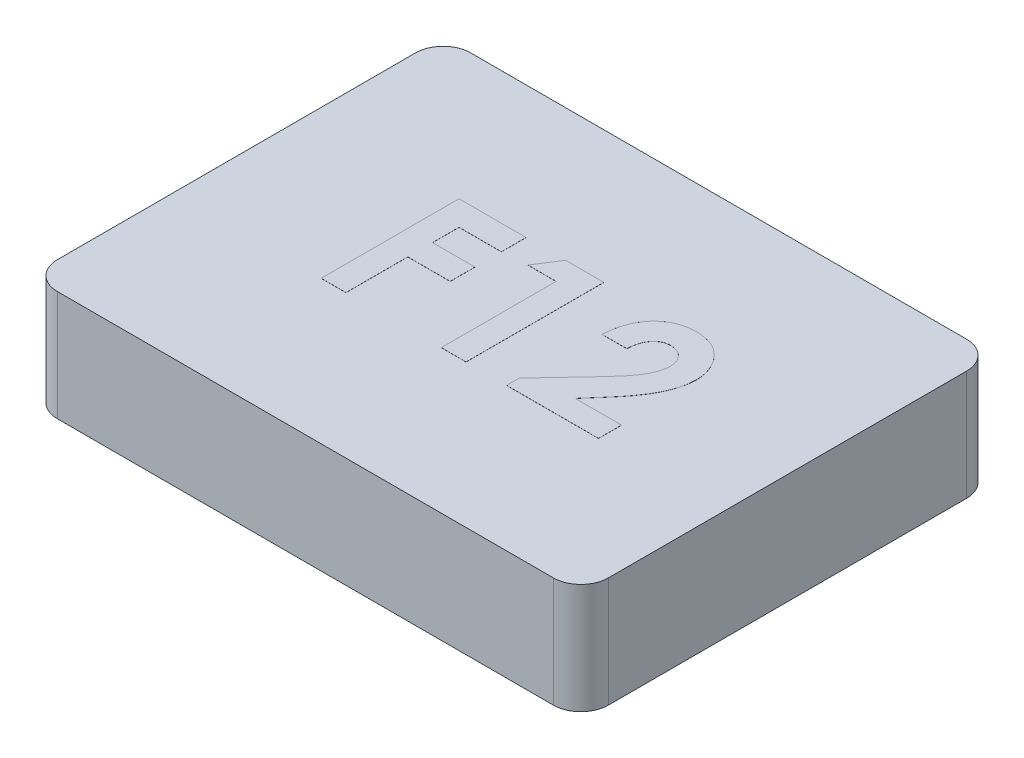
from build123d import *

# Parameters (mm, degrees)
SKETCH1_W           = 12.7
SKETCH1_H           = 9.525
BOSS_EXTRUDE1_DEPTH = 2.54
FILLET1_R           = 0.635
SHELL1_START        = 0.635
SHELL1_OUTLINE_W    = 1.905
SHELL1_OUTLINE_H    = 8.255
SHELL1_DEPTH        = 11.43
SKETCH2_R           = 2.54
BOSS_EXTRUDE2_DEPTH = 1.905
BOSS_EXTRUDE3_DEPTH = 0.00254


# Read off the part's stored shape, not the designer's step: Shell1
with BuildPart() as part:
    # Sketch1 → Boss-Extrude1 (new body)
    with BuildSketch(Plane(origin=(0, 0, 0), x_dir=(1, 0, 0), z_dir=(0, 1, 0))):
        with Locations((6.35, 4.7625)):
            Rectangle(SKETCH1_W, SKETCH1_H)
    extrude(amount=BOSS_EXTRUDE1_DEPTH)

    # Fillet1
    fillet1_edges = [part.edges().sort_by_distance(p)[0] for p in [
        (0, 1.27, -9.525),
        (12.7, 1.27, -9.525),
        (12.7, 1.27, 0),
        (0, 1.27, 0),
    ]]
    fillet(fillet1_edges, radius=FILLET1_R)

    # Shell1 outline → Shell1 (cut)
    with BuildSketch(Plane.YZ.offset(SHELL1_START)):
        with Locations((0.9525, -4.7625)):
            Rectangle(SHELL1_OUTLINE_W, SHELL1_OUTLINE_H)
    extrude(amount=SHELL1_DEPTH, mode=Mode.SUBTRACT)

    # Sketch2 → Boss-Extrude2 (add)
    with BuildSketch(Plane(origin=(0, 1.905, 0), x_dir=(-1, 0, 0), z_dir=(0, -1, 0))):
        with Locations(Location((-6.35, 4.7625, 0), (0, 0, 270))):
            Circle(SKETCH2_R)
    extrude(amount=BOSS_EXTRUDE2_DEPTH)

    # Sketch3 → Boss-Extrude3 (add)
    with BuildSketch(Plane(origin=(0, 2.54, 0), x_dir=(1, 0, 0), z_dir=(0, 1, 0))):
        Polygon((3.414346154, 6.477), (4.961141026, 6.477), (4.961141026, 5.907128205), (3.984217949, 5.907128205), (3.984217949, 5.296551282), (4.961141026, 5.296551282), (4.961141026, 4.726679487), (3.984217949, 4.726679487), (3.984217949, 3.302), (3.414346154, 3.302), align=None)
        Polygon((5.871282252, 6.477), (6.752166667, 6.477), (6.752166667, 3.302), (6.182294872, 3.302), (6.182294872, 5.947833333), (5.531012821, 5.947833333), align=None)
        with BuildLine():
            Line((8.339666667, 5.418666667), (7.769794872, 5.418666667))
            add(Edge.make_bspline(
                [(7.769794872, 5.418666667), (7.772256061, 5.461774453), (7.777065076, 5.54600448), (7.796194123, 5.66835129), (7.82182639, 5.783955572), (7.856036054, 5.89241293), (7.899022734, 5.993683952), (7.949680273, 6.088113879), (8.009302856, 6.175205533), (8.076621518, 6.254538911), (8.150493374, 6.325709616), (8.229384771, 6.388814034), (8.31450246, 6.440886212), (8.404291271, 6.483736794), (8.498735915, 6.517972417), (8.598729985, 6.540861702), (8.70340768, 6.55636255), (8.775068039, 6.557718936), (8.811591747, 6.558410256)],
                knots=[0, 0, 0, 0, 1.199038563, 2.342849363, 3.436047546, 4.486744587, 5.497670872, 6.488682221, 7.459191391, 8.424610317, 9.374430501, 10.305433194, 11.225809216, 12.140057399, 13.06607119, 14.010487599, 14.985989317, 16, 16, 16, 16], degree=3))
            add(Edge.make_bspline(
                [(8.811591747, 6.558410256), (8.85642408, 6.557011369), (8.9439473, 6.554280414), (9.071125482, 6.53098446), (9.189895998, 6.492018376), (9.300172515, 6.437572481), (9.401016227, 6.368404679), (9.492410414, 6.285933395), (9.571591168, 6.188428338), (9.639060519, 6.079946535), (9.695119486, 5.965079574), (9.734403276, 5.846302372), (9.760224087, 5.726766795), (9.762978037, 5.646277588), (9.764346154, 5.606291867)],
                knots=[0, 0, 0, 0, 1.075374347, 2.099382735, 3.09057751, 4.06680945, 5.040638231, 6.016817125, 7.011024321, 8.044445721, 9.0776792, 10.070479129, 11.0414456, 12, 12, 12, 12], degree=3))
            add(Edge.make_bspline(
                [(9.764346154, 5.606291867), (9.763813481, 5.582105677), (9.762741343, 5.53342485), (9.755286624, 5.459758812), (9.744103072, 5.384721339), (9.727241001, 5.308376769), (9.706212616, 5.230703702), (9.680702146, 5.151469689), (9.65011785, 5.071123958), (9.614970118, 4.98876223), (9.573038785, 4.904117111), (9.524215575, 4.815919737), (9.467204612, 4.724248345), (9.402694514, 4.62858533), (9.330371972, 4.529081566), (9.249883932, 4.426036789), (9.162157425, 4.319087904), (9.099895456, 4.247598577), (9.067906851, 4.210869191)],
                knots=[0, 0, 0, 0, 0.728284026, 1.46585585, 2.227944881, 3.01186502, 3.81876927, 4.650621989, 5.517437689, 6.406905708, 7.346299482, 8.360816762, 9.441613733, 10.596154504, 11.834900912, 13.145207542, 14.533280747, 16, 16, 16, 16], degree=3))
            Line((9.067906851, 4.210869191), (8.736541667, 3.831166667))
            Line((8.736541667, 3.831166667), (9.805051282, 3.831166667))
            Line((9.805051282, 3.831166667), (9.805051282, 3.302))
            Line((9.805051282, 3.302), (7.688384615, 3.302))
            Line((7.688384615, 3.302), (7.688384615, 3.590752003))
            Line((7.688384615, 3.590752003), (8.62841867, 4.591207732))
            add(Edge.make_bspline(
                [(8.62841867, 4.591207732), (8.655635071, 4.620391337), (8.70834517, 4.676911324), (8.783346208, 4.759916937), (8.851215523, 4.838687284), (8.910545788, 4.914061108), (8.96445058, 4.983593589), (9.010526288, 5.049380524), (9.049194469, 5.110827174), (9.091174264, 5.184921103), (9.131041269, 5.273291298), (9.167621659, 5.375097387), (9.189919938, 5.47240056), (9.192997806, 5.5358054), (9.194474359, 5.566222756)],
                knots=[0, 0, 0, 0, 1.246127091, 2.413378631, 3.493388633, 4.492180848, 5.408488754, 6.240484944, 6.999099869, 7.674939598, 8.898438119, 10.020720584, 11.050475521, 12, 12, 12, 12], degree=3))
            add(Edge.make_bspline(
                [(9.194474359, 5.566222756), (9.193370376, 5.595649202), (9.191231232, 5.652667658), (9.167723774, 5.733776109), (9.131305205, 5.807211531), (9.079986297, 5.870779591), (9.017823027, 5.923017682), (8.945987529, 5.961870906), (8.865065475, 5.984289038), (8.808337572, 5.987094988), (8.779154848, 5.988538462)],
                knots=[0, 0, 0, 0, 1.062038974, 2.057870785, 3.028805853, 4.01125022, 4.991535629, 5.949134679, 6.94496649, 8, 8, 8, 8], degree=3))
            add(Edge.make_bspline(
                [(8.779154848, 5.988538462), (8.764078681, 5.988005225), (8.734398824, 5.986955463), (8.690771755, 5.979967483), (8.649257465, 5.967651898), (8.609393876, 5.951150747), (8.571606422, 5.929278353), (8.535990417, 5.902317143), (8.5021706, 5.870952262), (8.470302083, 5.835281784), (8.441297572, 5.79547352), (8.415535872, 5.751891037), (8.394235234, 5.704561389), (8.375481378, 5.654109398), (8.361017507, 5.59999317), (8.350486015, 5.542536583), (8.342479625, 5.481833113), (8.340621377, 5.440105185), (8.339666667, 5.418666667)],
                knots=[0, 0, 0, 0, 0.903469896, 1.778625579, 2.63899355, 3.493148037, 4.358286772, 5.247621495, 6.164656832, 7.118446693, 8.109501108, 9.111810964, 10.146451449, 11.215617525, 12.33435995, 13.498009769, 14.714554818, 16, 16, 16, 16], degree=3))
        make_face()
    extrude(amount=BOSS_EXTRUDE3_DEPTH)


solid = part.part
